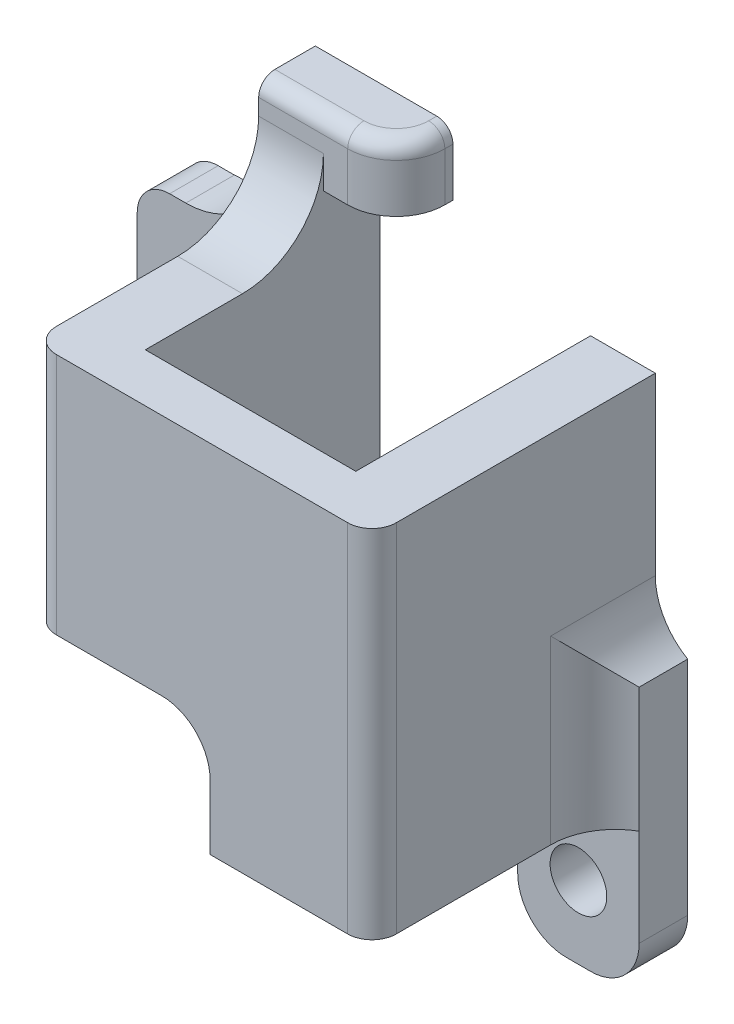
from build123d import *

# Parameters (mm, degrees)
SKETCH1_W           = 21
SKETCH1_H           = 15
BOSS_EXTRUDE1_DEPTH = 3
SKETCH2_W           = 4
SKETCH2_H           = 15
BOSS_EXTRUDE2_DEPTH = 14.5
SKETCH3_W           = 4
SKETCH3_H           = 7
SKETCH3_W_2         = 4.5
SKETCH3_H_2         = 4
BOSS_EXTRUDE3_DEPTH = 3.5
FILLET1_R           = 1
FILLET2_R           = 3
FILLET3_R           = 5
SKETCH4_W           = 8
SKETCH4_H           = 10
SKETCH4_R           = 1.75
BOSS_EXTRUDE4_DEPTH = 3
FILLET4_R           = 5
FILLET5_R           = 2
SKETCH7_W           = 8
SKETCH7_H           = 4
BOSS_EXTRUDE5_DEPTH = 10
SKETCH8_W           = 4
SKETCH8_H           = 3
BOSS_EXTRUDE6_DEPTH = 8
SKETCH9_R           = 4.5
CUT_EXTRUDE1_DEPTH  = 5
BOSS_EXTRUDE7_DEPTH = 6.5
SKETCH11_R          = 1.75
SKETCH11_W          = 2
SKETCH11_H          = 7.704965023
BOSS_EXTRUDE8_DEPTH = 3
FILLET6_R           = 4
FILLET7_START       = -17.5
FILLET7_DEPTH       = 3
FILLET7_START_2     = -14.5
FILLET7_2_DEPTH     = 3.464101615
FILLET7_START_3     = -6.795034977
FILLET7_3_DEPTH     = 4.795034977
FILLET8_R           = 3
FILLET9_R           = 3
FILLET10_R          = 1.5


with BuildPart() as part:
    # Sketch1 → Boss-Extrude1 (new body)
    with BuildSketch(Plane.XY):
        Rectangle(SKETCH1_W, SKETCH1_H)
    extrude(amount=-BOSS_EXTRUDE1_DEPTH)

    # Sketch2 → Boss-Extrude2 (add)
    with BuildSketch(Plane(origin=(0, 0, -3), x_dir=(-1, 0, 0), z_dir=(0, 0, -1))):
        with Locations((8.5, 0)):
            Rectangle(SKETCH2_W, SKETCH2_H)
        with Locations((-8.5, 0)):
            Rectangle(SKETCH2_W, SKETCH2_H)
    extrude(amount=BOSS_EXTRUDE2_DEPTH)

    # Sketch3 → Boss-Extrude3 (add)
    with BuildSketch(Plane(origin=(0, 0, -17.5), x_dir=(-1, 0, 0), z_dir=(0, 0, -1))):
        with Locations((8.5, 11)):
            Rectangle(SKETCH3_W, SKETCH3_H)
        with Locations((4.25, 12.5)):
            Rectangle(SKETCH3_W_2, SKETCH3_H_2)
    extrude(amount=-BOSS_EXTRUDE3_DEPTH)

    # Fillet1
    fillet1_edges = [part.edges().sort_by_distance(p)[0] for p in [
        (-6.25, 14.5, -14),
        (-2, 14.5, -15.75),
    ]]
    fillet(fillet1_edges, radius=FILLET1_R)

    # Fillet2
    # the kernel refuses this fillet: 3 mm, written as the material it takes off along each edge
    with BuildSketch(Plane(origin=(-5, 14.5, -17), x_dir=(0, 0, 1), z_dir=(-1, 0, 0))) as fillet2_piece_1:
        with BuildLine():
            CenterArc((2, -1), 1, 0, 90)
            Line((3, -1), (3, 0))
            Line((3, 0), (2, 0))
        make_face()
    revolve(axis=Axis((-5, 14.5, -17), (0, 1, 0)), revolution_arc=90, mode=Mode.SUBTRACT)
    with BuildSketch(Plane(origin=(-2, 14.5, -14), x_dir=(0, 0, -1), z_dir=(0, -1, 0))) as fillet2_piece_2:
        with BuildLine():
            CenterArc((FILLET2_R, -FILLET2_R), FILLET2_R, 90, 90)
            Line((0, -FILLET2_R), (0, 0))
            Line((0, 0), (FILLET2_R, 0))
        make_face()
    extrude(amount=11.5, mode=Mode.SUBTRACT)

    # Fillet3
    # the kernel refuses this fillet: 5 mm, written as the material it adds along each edge
    with BuildSketch(Plane(origin=(-10.5, 7.5, -14), x_dir=(0, 1, 0), z_dir=(1, 0, 0))) as fillet3_piece_1:
        with BuildLine():
            CenterArc((FILLET3_R, FILLET3_R), FILLET3_R, 180, 90)
            Line((0, FILLET3_R), (0, 0))
            Line((0, 0), (FILLET3_R, 0))
        make_face()
    extrude(amount=4)

    # Sketch4 → Boss-Extrude4 (add)
    with BuildSketch(Plane(origin=(0, 0, -17.5), x_dir=(-1, 0, 0), z_dir=(0, 0, -1))):
        with Locations((14.5, 0.098378943)):
            Rectangle(SKETCH4_W, SKETCH4_H)
        with Locations((14.5, 0.098378943)):
            Circle(SKETCH4_R, mode=Mode.SUBTRACT)
    extrude(amount=-BOSS_EXTRUDE4_DEPTH)

    # Fillet4
    # the kernel refuses this fillet: 5 mm, written as the material it adds along each edge
    with BuildSketch(Plane(origin=(-10.5, -4.901621057, -17.5), x_dir=(0, -1, 0), z_dir=(0, 0, 1))) as fillet4_piece_1:
        with BuildLine():
            CenterArc((5, -4.385455085), FILLET4_R, 118.706578905, 61.293421095)
            Line((0, -4.385455085), (0, 0))
            Line((0, 0), (2.598378943, 0))
        make_face()
    extrude(amount=3)
    with BuildSketch(Plane(origin=(-10.5, 5.098378943, -17.5), x_dir=(0, 1, 0), z_dir=(0, 0, 1))) as fillet4_piece_2:
        with BuildLine():
            CenterArc((FILLET4_R, FILLET4_R), FILLET4_R, 180, 90)
            Line((0, FILLET4_R), (0, 0))
            Line((0, 0), (FILLET4_R, 0))
        make_face()
    extrude(amount=3)

    # Fillet5
    fillet5_edges = [part.edges().sort_by_distance(p)[0] for p in [
        (-18.5, 5.098378943, -16),
        (-18.5, -4.901621057, -16),
    ]]
    fillet(fillet5_edges, radius=FILLET5_R)

    # Sketch7 → Boss-Extrude5 (add)
    with BuildSketch(Plane(origin=(10.5, 0, 0), x_dir=(0, 0, -1), z_dir=(1, 0, 0))):
        Polygon((3, -7.5), (0, -7.5), (0, -14.5), (3, -14.5), (3, -10.5), align=None)
        with Locations((7, -12.5)):
            Rectangle(SKETCH7_W, SKETCH7_H)
    extrude(amount=-BOSS_EXTRUDE5_DEPTH)

    # Sketch8 → Boss-Extrude6 (add)
    with BuildSketch(Plane(origin=(0, 0, -3), x_dir=(-1, 0, 0), z_dir=(0, 0, -1))):
        with Locations((-8.5, -9)):
            Rectangle(SKETCH8_W, SKETCH8_H)
    extrude(amount=BOSS_EXTRUDE6_DEPTH)

    # Sketch9 → Cut-Extrude1 (cut)
    with BuildSketch(Plane.XZ.offset(14.5)):
        with Locations((0.5, -11)):
            Circle(SKETCH9_R)
    extrude(amount=-CUT_EXTRUDE1_DEPTH, mode=Mode.SUBTRACT)

    # Sketch10 → Boss-Extrude7 (add)
    with BuildSketch(Plane(origin=(0, 0, -11), x_dir=(-1, 0, 0), z_dir=(0, 0, -1))):
        Polygon((-5, -14.5), (-5, -10.5), (-6.5, -10.5), (-6.5, -7.5), (-10.5, -7.5), (-10.5, -14.5), align=None)
    extrude(amount=BOSS_EXTRUDE7_DEPTH)

    # Sketch11 → Boss-Extrude8 (add)
    # profile 1 of 2: a face of its own
    with BuildSketch(Plane(origin=(0, 0, -17.5), x_dir=(-1, 0, 0), z_dir=(0, 0, -1))):
        Polygon((-5, -23.5), (-5, -14.5), (-10.5, -14.5), (-12.5, -14.5), (-12.5, -23.5), align=None)
        with Locations((-8.75, -19)):
            Circle(SKETCH11_R, mode=Mode.SUBTRACT)
    # profile 2 of 2: a face of its own
    with BuildSketch(Plane(origin=(0, 0, -17.5), x_dir=(-1, 0, 0), z_dir=(0, 0, -1))):
        with Locations((-11.5, -10.647517489)):
            Rectangle(SKETCH11_W, SKETCH11_H)
    extrude(amount=-BOSS_EXTRUDE8_DEPTH)

    # Fillet6
    # the kernel refuses this fillet: 4 mm, written as the material it adds along each edge
    with BuildSketch(Plane(origin=(10.5, -14.5, -14.5), x_dir=(0, 0, 1), z_dir=(0, 1, 0))) as fillet6_piece_1:
        with BuildLine():
            CenterArc((3.464101615, 4), FILLET6_R, 210, 60)
            Line((0, 2), (-0.069282032, 1.96))
            ThreePointArc((-0.069282032, 1.96), (-0.08, 1), (-0.08, 0))
            Line((-0.08, 0), (0, -0.08))
            Line((0, -0.08), (3.464101615, -0.08))
            Line((3.464101615, -0.08), (3.464101615, 0))
        make_face()
    extrude(amount=7.704965023)

    # Fillet7: read off the stored shape, not the designer's step
    # Fillet7 outline → Fillet7 (add)
    with BuildSketch(Plane.XY.offset(FILLET7_START)):
        with BuildLine():
            Line((10.5, -6.795034977), (12.5, -6.795034977))
            ThreePointArc((12.5, -6.795034977), (11.035898385, -5.330933362), (10.5, -3.330933362))
            Line((10.5, -3.330933362), (10.5, -6.795034977))
        make_face()
    extrude(amount=FILLET7_DEPTH)

    # Fillet7 2 outline → Fillet7 2 (add)
    with BuildSketch(Plane.XY.offset(FILLET7_START_2)):
        with BuildLine():
            Line((10.5, -6.795034977), (12.5, -6.795034977))
            ThreePointArc((12.5, -6.795034977), (11.035898385, -5.330933362), (10.5, -3.330933362))
            Line((10.5, -3.330933362), (10.5, -6.795034977))
        make_face()
    extrude(amount=FILLET7_2_DEPTH)

    # Fillet7 3 outline → Fillet7 3 (cut)
    with BuildSketch(Plane(origin=(0, 0, 0), x_dir=(1, 0, 0), z_dir=(0, 1, 0)).offset(FILLET7_START_3)):
        with BuildLine():
            ThreePointArc((12.5, 14.5), (11.035898385, 13.035898385), (10.5, 11.035898385))
            Line((10.5, 11.035898385), (14, 11.035898385))
            Line((14, 11.035898385), (14, 15.366025404))
            Line((14, 15.366025404), (12.5, 14.5))
        make_face()
    extrude(amount=FILLET7_3_DEPTH, mode=Mode.SUBTRACT)

    # Fillet8
    fillet8_edges = [part.edges().sort_by_distance(p)[0] for p in [
        (5, -23.5, -16),
        (12.5, -23.5, -16),
    ]]
    fillet(fillet8_edges, radius=FILLET8_R)

    # Fillet9
    fillet9_edges = [part.edges().sort_by_distance(p)[0] for p in [
        (0.5, -7.5, -1.5),
        (0.5, -12.5, -6.5),
    ]]
    fillet(fillet9_edges, radius=FILLET9_R)

    # Fillet10
    fillet10_edges = [part.edges().sort_by_distance(p)[0] for p in [
        (10.5, -3.5, 0),
        (-10.5, 0, 0),
    ]]
    fillet(fillet10_edges, radius=FILLET10_R)


solid = part.part
